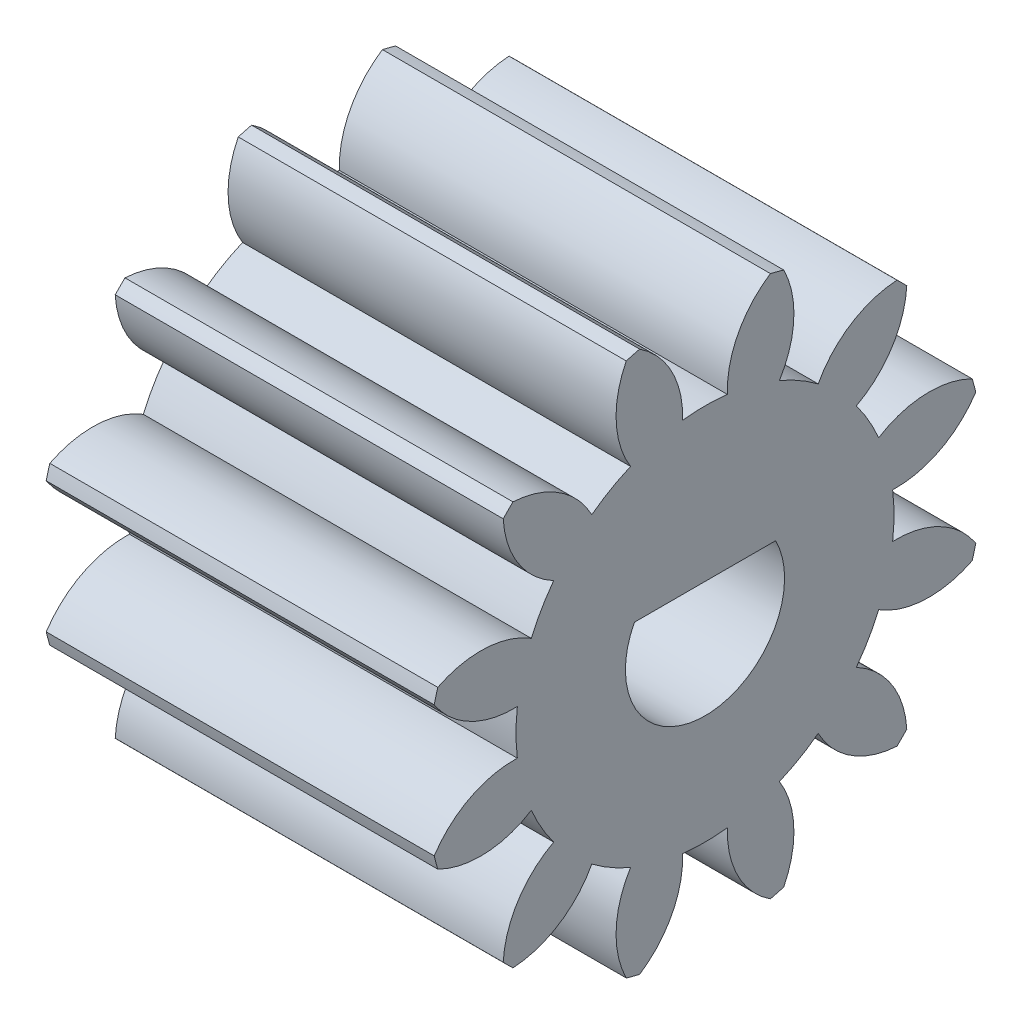
from build123d import *

# Parameters (mm, degrees)
BASPROSKE_W        = 9.75
BASPROSKE_H        = 7
TOOTHCUT_DEPTH     = 14.894693232
TEETHCUTS_COUNT    = 12
TEETHCUTS_ANGLE    = 330
BORSKE_R           = 0.4
BORE_DEPTH         = 50.0000508
SCALE1_SCALE       = 2
CUT_EXTRUDE1_DEPTH = 15
CUT_EXTRUDE2_START = -5
SKETCH5_R          = 4
CUT_EXTRUDE2_DEPTH = 5


with BuildPart() as part:
    # BasProSke → Base-Revolve (revolve)
    with BuildSketch(Plane(origin=(0, 0, 0), x_dir=(1, 0, 0), z_dir=(0, 1, 0))):
        with Locations((4.875, 3.5)):
            Rectangle(BASPROSKE_W, BASPROSKE_H)
    revolve(axis=Axis((-10, 0, 0), (1, 0, 0)))

    # TooCutSke → ToothCut (cut, through all)
    with BuildSketch(Plane(origin=(0, 0, 0), x_dir=(0, 0, -1), z_dir=(1, 0, 0))):
        with BuildLine():
            ThreePointArc((0.562207301, 4.715604304), (0, 4.749), (-0.562207301, 4.715604304))
            ThreePointArc((-0.562207301, 4.715604304), (-0.837528627, 5.917009812), (-1.672850686, 6.823328788))
            ThreePointArc((-1.672850686, 6.823328788), (0, 7.0254), (1.672850686, 6.823328788))
            ThreePointArc((1.672850686, 6.823328788), (0.837528627, 5.917009812), (0.562207301, 4.715604304))
        make_face()
    toothcut = extrude(amount=TOOTHCUT_DEPTH, mode=Mode.SUBTRACT)

    # TeethCuts: ToothCut ×12 about axis
    teethcuts_axis = Axis((-10, 0, 0), (1, 0, 0))
    for i in range(1, TEETHCUTS_COUNT):
        add(toothcut.rotate(teethcuts_axis, i * TEETHCUTS_ANGLE / (TEETHCUTS_COUNT - 1)), mode=Mode.SUBTRACT)

    # BorSke → Bore (cut, symmetric)
    with BuildSketch(Plane(origin=(0, 0, 0), x_dir=(0, 0, -1), z_dir=(1, 0, 0))):
        Circle(BORSKE_R)
    extrude(amount=BORE_DEPTH, both=True, mode=Mode.SUBTRACT)


with BuildPart() as part_1:
    # Scale1: scaled about (4.875, 0, 0)
    add(part.part.scale(SCALE1_SCALE).moved(Location((-4.875, 0, 0))))

    # Sketch4 → Cut-Extrude1 (cut)
    with BuildSketch(Plane(origin=(14.625, 0, 0), x_dir=(0, 0, -1), z_dir=(1, 0, 0))):
        with BuildLine():
            Line((0, 1.85), (-3.546477125, 1.85))
            ThreePointArc((-3.546477125, 1.85), (0, -4), (3.546477125, 1.85))
            Line((3.546477125, 1.85), (0, 1.85))
        make_face()
    extrude(amount=-CUT_EXTRUDE1_DEPTH, mode=Mode.SUBTRACT)

    # Sketch5 → Cut-Extrude2 (cut)
    with BuildSketch(Plane.ZY.offset(4.875).offset(CUT_EXTRUDE2_START)):
        Circle(SKETCH5_R)
    extrude(amount=CUT_EXTRUDE2_DEPTH, mode=Mode.SUBTRACT)


solid = part_1.part
